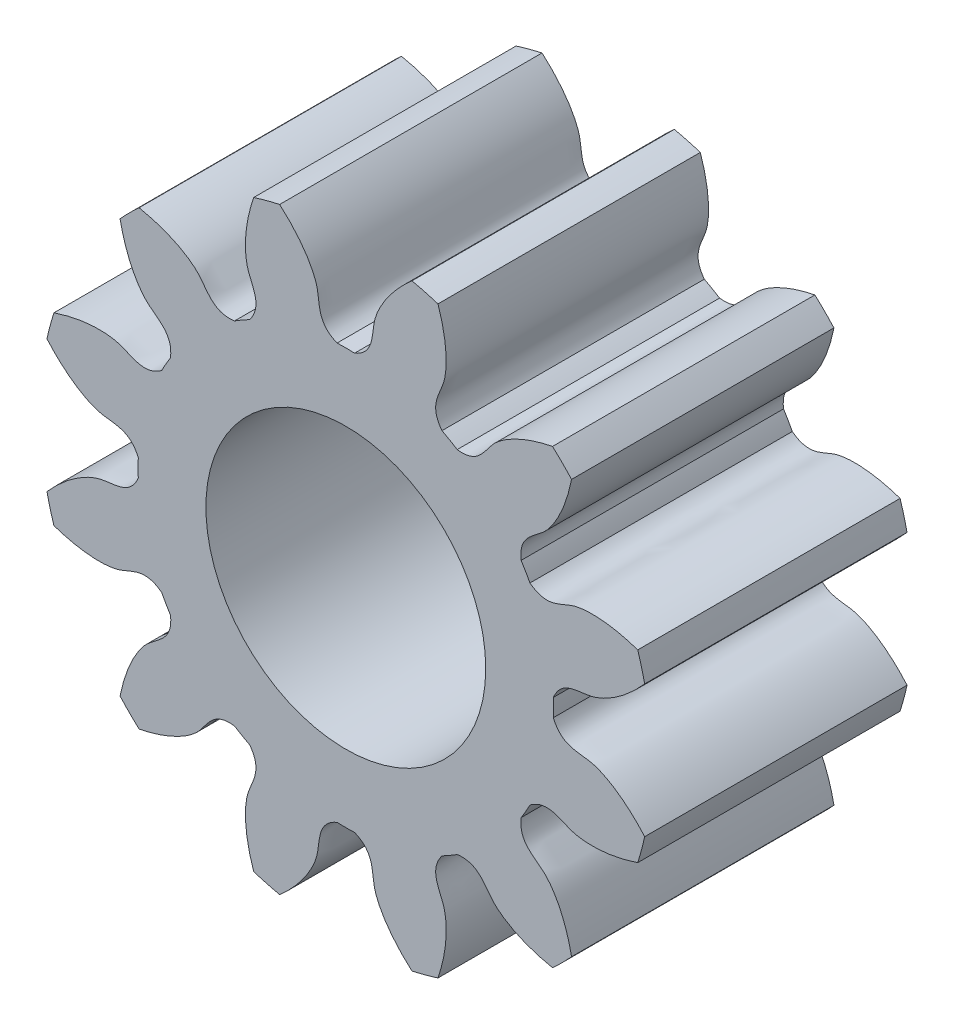
from build123d import *

# Parameters (mm, degrees)
SKETCH_1_R               = 3.5
EXTRUDE_1_DEPTH          = 3
CUT_EXTRUDE_1_DEPTH      = 6.787918451
PATTERN_CIRCULAR_1_COUNT = 12
CUT_EXTRUDE_2_REACH      = 7.688
SKETCH_4_R               = 1.6


with BuildPart() as part:
    # 草图1 → 凸台-拉伸1 (new body)
    with BuildSketch(Plane.XY):
        Circle(SKETCH_1_R)
    extrude(amount=EXTRUDE_1_DEPTH)

    # 草图2 → 切除-拉伸1 (cut, through all)
    with BuildSketch(Plane.XY):
        with BuildLine():
            ThreePointArc((0.100420056, 2.372876063), (0, 2.375), (-0.100420056, 2.372876063))
            add(Edge.make_bspline(
                [(-0.100420056, 2.372876063), (-0.340394435, 2.474653731), (-0.287186739, 2.672409341), (-0.338076094, 2.844740289), (-0.341311927, 2.854952869), (-0.345113625, 2.866166713), (-0.349521434, 2.878363044), (-0.354576313, 2.891521619), (-0.360318258, 2.905621034), (-0.36678678, 2.920638648), (-0.374020716, 2.936550626), (-0.382058239, 2.95333195), (-0.390936819, 2.970956436), (-0.400693193, 2.989396753), (-0.411363332, 3.008624444), (-0.422982412, 3.02860994), (-0.435584786, 3.049322589), (-0.449203949, 3.07073067), (-0.463872517, 3.092801417), (-0.479622192, 3.115501045), (-0.496483738, 3.138794769), (-0.514486952, 3.162646832), (-0.533660639, 3.187020528), (-0.554032585, 3.211878226), (-0.575629533, 3.237181399), (-0.598477155, 3.262890651), (-0.622600033, 3.288965742), (-0.648021632, 3.315365616), (-0.674764279, 3.342048434), (-0.702849139, 3.368971597), (-0.732296196, 3.396091781), (-0.763124233, 3.423364967), (-0.795350811, 3.450746465), (-0.828992247, 3.478190957), (-0.864063604, 3.505652518), (-0.900578664, 3.533084654), (-0.938549918, 3.560440334), (-0.977988547, 3.587672024), (-1.01890441, 3.614731718), (-1.061306025, 3.641570973), (-1.10520056, 3.668140947), (-1.150593819, 3.694392428), (-1.197490231, 3.720275872), (-1.245892835, 3.74574144), (-1.295803277, 3.770739031), (-1.347221796, 3.79521832), (-1.400147219, 3.819128792), (-1.454576948, 3.842419781), (-1.510506963, 3.865040505), (-1.567931802, 3.886940103), (-1.647189853, 3.915363979), (-1.7077968, 3.935050704), (-1.748802701, 3.947485455)],
                knots=[0, 0, 0, 0, 0.218015236, 0.222043642, 0.226545979, 0.231522246, 0.236972443, 0.24289657, 0.249294627, 0.256166614, 0.263512532, 0.271332379, 0.279626157, 0.288393865, 0.297635503, 0.307351072, 0.31754057, 0.328203999, 0.339341357, 0.350952646, 0.363037866, 0.375597015, 0.388630094, 0.402137104, 0.416118043, 0.430572913, 0.445501713, 0.460904444, 0.476781104, 0.493131694, 0.509956215, 0.527254666, 0.545027047, 0.563273358, 0.581993599, 0.601187771, 0.620855872, 0.640997904, 0.661613866, 0.682703758, 0.704267581, 0.726305333, 0.748817015, 0.771802628, 0.795262171, 0.819195644, 0.843603047, 0.868484381, 0.893839644, 0.919668838, 0.945971962, 1, 1, 1, 1], degree=3))
            ThreePointArc((-1.748802701, 3.947485455), (0, 4.317516914), (1.748802701, 3.947485455))
            add(Edge.make_bspline(
                [(0.100420056, 2.372876063), (0.340394435, 2.474653731), (0.287186739, 2.672409341), (0.338076094, 2.844740289), (0.341311927, 2.854952869), (0.345113625, 2.866166713), (0.349521434, 2.878363044), (0.354576313, 2.891521619), (0.360318258, 2.905621034), (0.36678678, 2.920638648), (0.374020716, 2.936550626), (0.382058239, 2.95333195), (0.390936819, 2.970956436), (0.400693193, 2.989396753), (0.411363332, 3.008624444), (0.422982412, 3.02860994), (0.435584786, 3.049322589), (0.449203949, 3.07073067), (0.463872517, 3.092801417), (0.479622192, 3.115501045), (0.496483738, 3.138794769), (0.514486952, 3.162646832), (0.533660639, 3.187020528), (0.554032585, 3.211878226), (0.575629533, 3.237181399), (0.598477155, 3.262890651), (0.622600033, 3.288965742), (0.648021632, 3.315365616), (0.674764279, 3.342048434), (0.702849139, 3.368971597), (0.732296196, 3.396091781), (0.763124233, 3.423364967), (0.795350811, 3.450746465), (0.828992247, 3.478190957), (0.864063604, 3.505652518), (0.900578664, 3.533084654), (0.938549918, 3.560440334), (0.977988547, 3.587672024), (1.01890441, 3.614731718), (1.061306025, 3.641570973), (1.10520056, 3.668140947), (1.150593819, 3.694392428), (1.197490231, 3.720275872), (1.245892835, 3.74574144), (1.295803277, 3.770739031), (1.347221796, 3.79521832), (1.400147219, 3.819128792), (1.454576948, 3.842419781), (1.510506963, 3.865040505), (1.567931802, 3.886940103), (1.647189853, 3.915363979), (1.7077968, 3.935050704), (1.748802701, 3.947485455)],
                knots=[0, 0, 0, 0, 0.218015236, 0.222043642, 0.226545979, 0.231522246, 0.236972443, 0.24289657, 0.249294627, 0.256166614, 0.263512532, 0.271332379, 0.279626157, 0.288393865, 0.297635503, 0.307351072, 0.31754057, 0.328203999, 0.339341357, 0.350952646, 0.363037866, 0.375597015, 0.388630094, 0.402137104, 0.416118043, 0.430572913, 0.445501713, 0.460904444, 0.476781104, 0.493131694, 0.509956215, 0.527254666, 0.545027047, 0.563273358, 0.581993599, 0.601187771, 0.620855872, 0.640997904, 0.661613866, 0.682703758, 0.704267581, 0.726305333, 0.748817015, 0.771802628, 0.795262171, 0.819195644, 0.843603047, 0.868484381, 0.893839644, 0.919668838, 0.945971962, 1, 1, 1, 1], degree=3))
        make_face()
    cut_extrude_1 = extrude(amount=CUT_EXTRUDE_1_DEPTH, mode=Mode.SUBTRACT)

    # 阵列(圆周)1: 切除-拉伸1 ×12 about axis
    pattern_circular_1_axis = Axis((0, 0, 3), (0, 0, -1))
    for i in range(1, PATTERN_CIRCULAR_1_COUNT):
        add(cut_extrude_1.rotate(pattern_circular_1_axis, i * 360 / PATTERN_CIRCULAR_1_COUNT), mode=Mode.SUBTRACT)

    # 草图4 → 切除-拉伸2 (cut, up to next)
    with BuildSketch(Plane.XY.offset(3), mode=Mode.PRIVATE) as cut_extrude_2_sk1:
        Circle(SKETCH_4_R)
    cut_extrude_2_tool1 = extrude(cut_extrude_2_sk1.sketch, amount=-CUT_EXTRUDE_2_REACH, mode=Mode.PRIVATE) & part.part
    add(cut_extrude_2_tool1.solids().sort_by_distance((0, 0, 3))[0], mode=Mode.SUBTRACT)


solid = part.part
